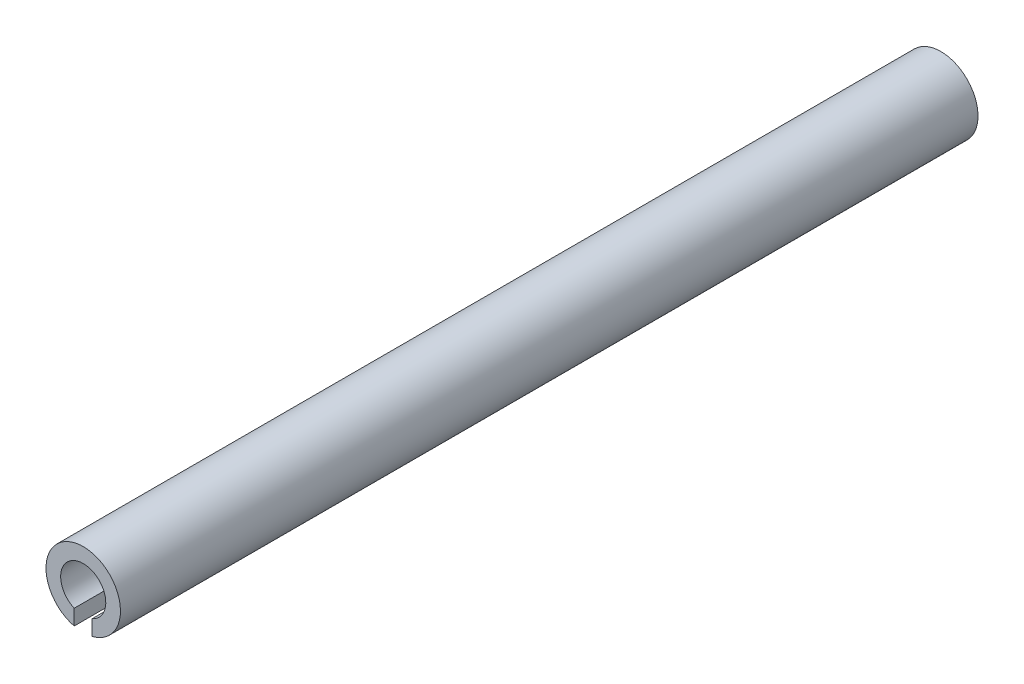
from build123d import *

# Parameters (mm, degrees)
BOSS_EXTRUDE1_DEPTH = 38


with BuildPart() as part:
    # Sketch1 → Boss-Extrude1 (new body)
    with BuildSketch(Plane.XY):
        with BuildLine():
            Line((-0.4, -1.600781059), (-0.4, -0.916515139))
            ThreePointArc((-0.4, -0.916515139), (-0.547722558, 0.836660027), (1, 0))
            ThreePointArc((1, 0), (0.836660027, -0.547722558), (0.4, -0.916515139))
            Line((0.4, -0.916515139), (0.4, -1.600781059))
            ThreePointArc((0.4, -1.600781059), (1.30048068, -1.015504801), (1.65, 0))
            ThreePointArc((1.65, 0), (-1.015504801, 1.30048068), (-0.4, -1.600781059))
        make_face()
    extrude(amount=BOSS_EXTRUDE1_DEPTH)


solid = part.part
